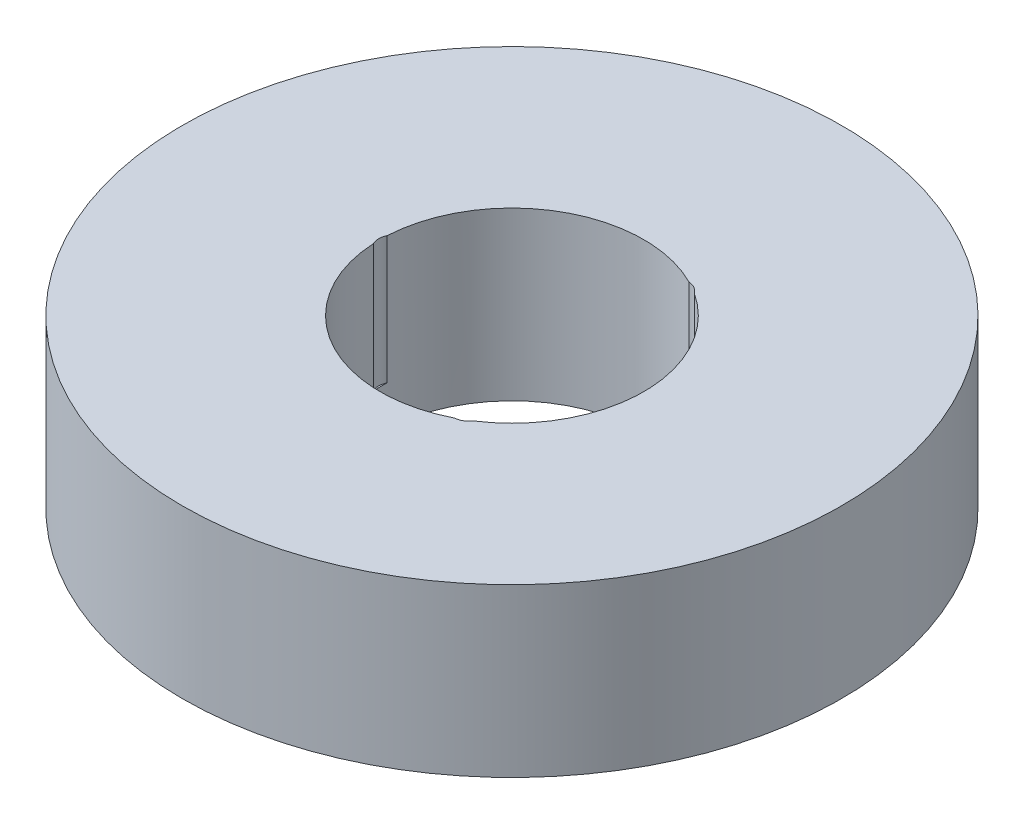
from build123d import *

# Parameters (mm, degrees)
SKETCH1_R           = 37.5
BOSS_EXTRUDE1_DEPTH = 19
SKETCH2_R           = 15
CUT_EXTRUDE1_DEPTH  = 57.333826428
SKETCH3_R           = 1.781466064
CUT_EXTRUDE2_DEPTH  = 14.510064194
CIRPATTERN1_COUNT   = 3


with BuildPart() as part:
    # Sketch1 → Boss-Extrude1 (new body)
    with BuildSketch(Plane(origin=(0, 0, 0), x_dir=(1, 0, 0), z_dir=(0, 1, 0))):
        Circle(SKETCH1_R)
    extrude(amount=BOSS_EXTRUDE1_DEPTH)

    # Sketch2 → Cut-Extrude1 (cut, through all)
    with BuildSketch(Plane(origin=(0, 0, 0), x_dir=(1, 0, 0), z_dir=(0, 1, 0))):
        Circle(SKETCH2_R)
    extrude(amount=CUT_EXTRUDE1_DEPTH, mode=Mode.SUBTRACT)

    # Sketch3 → Cut-Extrude2 (cut)
    with BuildSketch(Plane(origin=(0, 19, 0), x_dir=(1, 0, 0), z_dir=(0, 1, 0))):
        with Locations((-13.380397006, 0)):
            Circle(SKETCH3_R)
    cut_extrude2 = extrude(amount=-CUT_EXTRUDE2_DEPTH, mode=Mode.SUBTRACT)

    # CirPattern1: Cut-Extrude2 ×3 about axis
    cirpattern1_axis = Axis((0, 0, 0), (0, 1, 0))
    for i in range(1, CIRPATTERN1_COUNT):
        add(cut_extrude2.rotate(cirpattern1_axis, i * 360 / CIRPATTERN1_COUNT), mode=Mode.SUBTRACT)


solid = part.part
